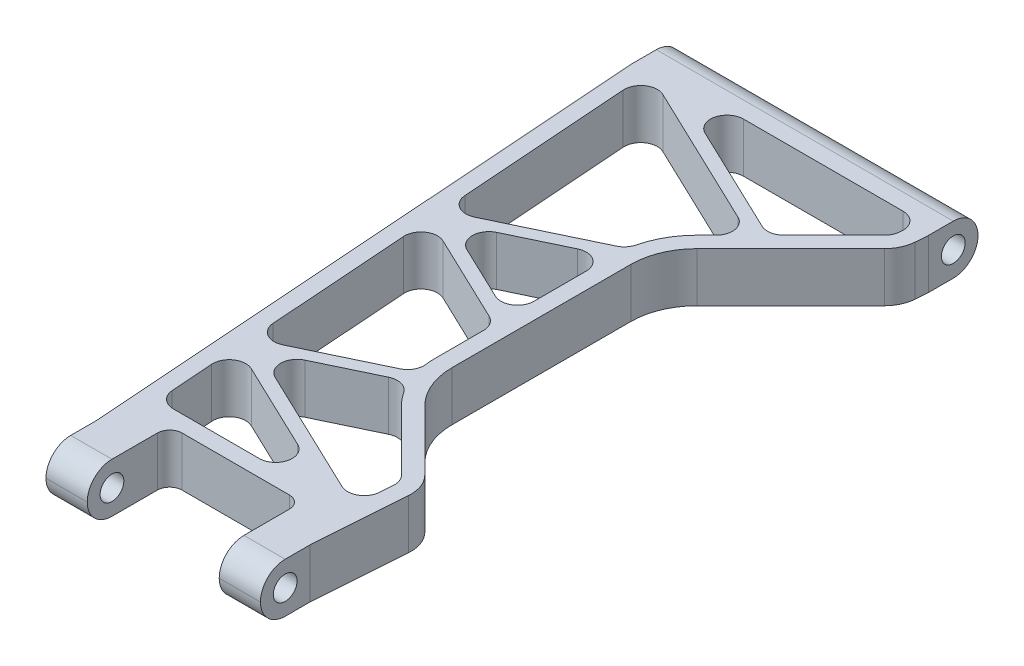
from build123d import *

# Parameters (mm, degrees)
BOSS_EXTRUDE1_DEPTH     = 9.525
CUT_EXTRUDE2_DEPTH      = 139.148989433
CUT_EXTRUDE2_DEPTH_BACK = 139.148989433
SKETCH6_R               = 2.286
FILLET5_R               = 4.7625
FILLET6_R               = 12.7
FILLET7_R               = 6.35
CUT_EXTRUDE3_DEPTH      = 129.978879691
CUT_EXTRUDE3_DEPTH_BACK = 129.978879691
FILLET8_R               = 3.175
FILLET9_R               = 2.38125


# Some blends are built 0.0001 mm under size
with BuildPart() as part:
    # Sketch1 → Boss-Extrude1 (new body)
    with BuildSketch(Plane(origin=(0, 0, 0), x_dir=(1, 0, 0), z_dir=(0, 1, 0))):
        Polygon((-28.575, 4.7625), (-28.575, -4.7625), (-20.6375, -115.8875), (-20.6375, -125.4125), (-12.7, -125.4125), (-12.7, -109.5375), (12.7, -109.5375), (12.7, -125.4125), (20.6375, -125.4125), (20.6375, -115.8875), (22.111607143, -95.25), (4.7625, -77.900892857), (4.7625, -32.997321429), (28.234821429, -9.525), (28.575, -4.7625), (28.575, 4.7625), align=None)
    extrude(amount=BOSS_EXTRUDE1_DEPTH)

    # Sketch6 → Cut-Extrude2 (cut, two sides: drawn at the far end of the back side and taken through both)
    with BuildSketch(Plane.ZY.offset(28.575).offset(-CUT_EXTRUDE2_DEPTH_BACK)):
        with Locations((0, 4.7625)):
            Circle(SKETCH6_R)
        with Locations((120.65, 4.7625)):
            Circle(SKETCH6_R)
    extrude(amount=CUT_EXTRUDE2_DEPTH + CUT_EXTRUDE2_DEPTH_BACK, mode=Mode.SUBTRACT)

    # Fillet5
    fillet5_edges = [part.edges().sort_by_distance(p)[0] for p in [
        (0, 0, -4.7625),
        (0, 9.525, -4.7625),
        (16.66875, 0, 125.4125),
        (16.66875, 9.525, 125.4125),
        (-16.66875, 0, 125.4125),
        (-16.66875, 9.525, 125.4125),
    ]]
    fillet(fillet5_edges, radius=FILLET5_R - 0.0001)  # a hair under: the kernel refuses the full size

    # Fillet6
    fillet6_edges = [part.edges().sort_by_distance(p)[0] for p in [
        (4.7625, 4.7625, 32.997321429),
        (4.7625, 4.7625, 77.900892857),
    ]]
    fillet(fillet6_edges, radius=FILLET6_R)

    # Fillet7
    fillet7_edges = [part.edges().sort_by_distance(p)[0] for p in [
        (28.234821429, 4.7625, 9.525),
        (22.111607143, 4.7625, 95.25),
    ]]
    fillet(fillet7_edges, radius=FILLET7_R)

    # Sketch7 → Cut-Extrude3 (cut, two sides: drawn at the far end of the back side and taken through both)
    with BuildSketch(Plane.XZ.offset(-CUT_EXTRUDE3_DEPTH_BACK)):
        with BuildLine():
            ThreePointArc((-15.178464487, 106.3625), (-17.342073764, 105.511165186), (-18.345395859, 103.413709384))
            Line((-18.345395859, 103.413709384), (-18.929176024, 95.240787072))
            ThreePointArc((-18.929176024, 95.240787072), (-17.550554149, 92.391111633), (-14.394156229, 92.149449581))
            Line((-14.394156229, 92.149449581), (2.722039645, 100.322371894))
            ThreePointArc((2.722039645, 100.322371894), (4.450514376, 103.888871251), (1.353951221, 106.3625))
            Line((1.353951221, 106.3625), (-15.178464487, 106.3625))
        make_face()
        with BuildLine():
            Line((-10.652026542, 85.567257834), (2.949065003, 79.072785266))
            ThreePointArc((2.949065003, 79.072785266), (4.371896924, 81.621011779), (6.237179849, 83.865700766))
            Line((6.237179849, 83.865700766), (17.816220953, 95.444741871))
            ThreePointArc((17.816220953, 95.444741871), (18.545921053, 96.580119743), (18.738088295, 97.916015285))
            Line((18.738088295, 97.916015285), (18.355750526, 103.268744039))
            ThreePointArc((18.355750526, 103.268744039), (16.767104452, 103.883635913), (15.089301508, 103.588906124))
            Line((15.089301508, 103.588906124), (-10.652026542, 91.297514046))
            ThreePointArc((-10.652026542, 91.297514046), (-12.458938118, 88.43238594), (-10.652026542, 85.567257834))
        make_face()
        with BuildLine():
            ThreePointArc((-15.303455952, 85.149509664), (-18.268395024, 85.028592375), (-19.838475748, 82.510590942))
            Line((-19.838475748, 82.510590942), (-21.768351953, 55.492324069))
            ThreePointArc((-21.768351953, 55.492324069), (-20.389730078, 52.642648631), (-17.233332157, 52.400986579))
            Line((-17.233332157, 52.400986579), (1.5875, 61.38786662))
            Line((1.5875, 61.38786662), (1.5875, 72.640380615))
            ThreePointArc((1.5875, 72.640380615), (1.727944926, 74.747369375), (2.146794694, 76.817077393))
            Line((2.146794694, 76.817077393), (-15.303455952, 85.149509664))
        make_face()
        with BuildLine():
            Line((1.5875, 38.618768332), (1.5875, 58.749077544))
            Line((1.5875, 58.749077544), (-13.49120247, 51.549051044))
            ThreePointArc((-13.49120247, 51.549051044), (-15.298114047, 48.683922938), (-13.49120247, 45.818794832))
            Line((-13.49120247, 45.818794832), (1.5875, 38.618768332))
        make_face()
        with BuildLine():
            ThreePointArc((-18.142631881, 45.401046662), (-21.107570953, 45.280129373), (-22.677651676, 42.76212794))
            Line((-22.677651676, 42.76212794), (-25.022707709, 9.93134348))
            ThreePointArc((-25.022707709, 9.93134348), (-23.644085834, 7.081668041), (-20.487687914, 6.84000599))
            Line((-20.487687914, 6.84000599), (11.26695768, 22.002735688))
            Line((11.26695768, 22.002735688), (6.237179849, 27.032513519))
            ThreePointArc((6.237179849, 27.032513519), (3.290050222, 31.105401057), (1.764238406, 35.895587299))
            Line((1.764238406, 35.895587299), (-18.142631881, 45.401046662))
        make_face()
        with BuildLine():
            ThreePointArc((-9.987271687, 9.215128106), (-11.715746418, 5.648628749), (-8.619183264, 3.175))
            Line((-8.619183264, 3.175), (22.095428773, 3.175))
            ThreePointArc((22.095428773, 3.175), (24.419093959, 4.186390723), (25.262360145, 6.576209384))
            Line((25.262360145, 6.576209384), (25.236657334, 6.936048729))
            ThreePointArc((25.236657334, 6.936048729), (24.957868459, 8.028648627), (24.314789993, 8.954903375))
            Line((24.314789993, 8.954903375), (13.052944458, 20.21674891))
            Line((13.052944458, 20.21674891), (-9.987271687, 9.215128106))
        make_face()
    extrude(amount=CUT_EXTRUDE3_DEPTH + CUT_EXTRUDE3_DEPTH_BACK, mode=Mode.SUBTRACT)

    # Fillet8
    # the kernel refuses this fillet: 3.175 mm, written as the material it adds along each edge
    with BuildSketch(Plane(origin=(2.146794694, 0, 76.817077393), x_dir=(-0.19425863373245403, 0, -0.9809503469699169), z_dir=(0, 1, 0))) as fillet8_piece_1:
        with BuildLine():
            CenterArc((2.468233166, 3.167061169), FILLET8_R, 194.322890181, 71.624501931)
            Line((-0.608078232, 2.381610227), (0, 0))
            ThreePointArc((0, 0), (1.121924166, 0.039694156), (2.243848333, 0))
        make_face()
    extrude(amount=9.525)
    with BuildSketch(Plane(origin=(1.5875, 0, 61.38786662), x_dir=(0, 0, 1), z_dir=(0, 1, 0))) as fillet8_piece_2:
        with BuildLine():
            CenterArc((FILLET8_R * 0.630656469631, -FILLET8_R), FILLET8_R, 90, 64.475691518)
            Line((-FILLET8_R * 0.271746083545, -FILLET8_R * 0.569106008372), (0, 0))
            Line((0, 0), (FILLET8_R * 0.630656469631, 0))
        make_face()
    extrude(amount=9.525)
    with BuildSketch(Plane(origin=(2.949065003, 9.525, 79.072785266), x_dir=(0.482167275870273, 0, 0.8760791734083397), z_dir=(0, -1, 0))) as fillet8_piece_3:
        with BuildLine():
            CenterArc((2.997736865, 3.163282633), FILLET8_R, 183.302737657, 81.773303175)
            Line((-0.171989666, 2.980365394), (0, 0))
            ThreePointArc((0, 0), (1.362607666, 0.058586837), (2.725215332, 0))
        make_face()
    extrude(amount=9.525)
    with BuildSketch(Plane(origin=(18.355750526, 0, 103.268744039), x_dir=(-0.9990488574203268, 0, -0.04360482183359276), z_dir=(0, 1, 0))) as fillet8_piece_4:
        with BuildLine():
            CenterArc((3.095288472, -2.922058213), FILLET8_R, 66.97485618, 111.438691702)
            Line((-0.078494517, -2.834157465), (-0.395872815, -2.82536739))
            Line((-0.395872815, -2.82536739), (-0.317378299, 0.008790075))
            Line((-0.317378299, 0.008790075), (-0.200752777, 0.245976772))
            ThreePointArc((-0.200752777, 0.245976772), (3.373566927, 0.754496314), (4.461327625, 0.292205821))
            Line((4.461327625, 0.292205821), (4.337142248, 0))
        make_face()
    extrude(amount=9.525)
    with BuildSketch(Plane(origin=(1.764238406, 9.525, 35.895587299), x_dir=(-0.9024025531760991, 0, 0.4308939916281702), z_dir=(0, -1, 0))) as fillet8_piece_5:
        with BuildLine():
            CenterArc((1.589224556, 3.175), FILLET8_R, 219.319739753, 50.680260247)
            ThreePointArc((-0.867025133, 1.163169374), (-0.420218411, 0.591494135), (0, 0))
            Line((0, 0), (1.589224556, 0))
        make_face()
    extrude(amount=9.525)
    with BuildSketch(Plane(origin=(11.26695768, 9.525, 22.002735688), x_dir=(-0.7071067811865471, 0, 0.7071067811865479), z_dir=(0, -1, 0))) as fillet8_piece_6:
        with BuildLine():
            CenterArc((FILLET8_R * 1.4143306163, FILLET8_R), FILLET8_R, 160.524308482, 109.475691518)
            Line((FILLET8_R * 0.471547588134, FILLET8_R * 1.33340690126), (0, 0))
            Line((0, 0), (FILLET8_R * 1.4143306163, 0))
        make_face()
    extrude(amount=9.525)
    with BuildSketch(Plane(origin=(1.5875, 0, 58.749077544), x_dir=(-0.9024025531760999, 0, -0.4308939916281688), z_dir=(0, 1, 0))) as fillet8_piece_7:
        with BuildLine():
            CenterArc((FILLET8_R * 1.58564931647, -FILLET8_R), FILLET8_R, 90, 115.524308482)
            Line((FILLET8_R * 0.683246763298, -FILLET8_R * 1.43089399163), (0, 0))
            Line((0, 0), (FILLET8_R * 1.58564931647, 0))
        make_face()
    extrude(amount=9.525)
    with BuildSketch(Plane(origin=(1.5875, 9.525, 38.618768332), x_dir=(0, 0, 1), z_dir=(0, -1, 0))) as fillet8_piece_8:
        with BuildLine():
            CenterArc((FILLET8_R * 1.58564931647, FILLET8_R), FILLET8_R, 154.475691518, 115.524308482)
            Line((FILLET8_R * 0.683246763298, FILLET8_R * 1.43089399163), (0, 0))
            Line((0, 0), (FILLET8_R * 1.58564931647, 0))
        make_face()
    extrude(amount=9.525)
    with BuildSketch(Plane(origin=(13.052944458, 9.525, 20.21674891), x_dir=(-0.9024025531761012, 0, -0.4308939916281661), z_dir=(0, -1, 0))) as fillet8_piece_9:
        with BuildLine():
            CenterArc((FILLET8_R * 0.707048259068, FILLET8_R), FILLET8_R, 199.475691518, 70.524308482)
            Line((-FILLET8_R * 0.235734769096, FILLET8_R * 0.666593098742), (0, 0))
            Line((0, 0), (FILLET8_R * 0.707048259068, 0))
        make_face()
    extrude(amount=9.525)

    # Fillet9
    fillet9_edges = [part.edges().sort_by_distance(p)[0] for p in [
        (12.7, 4.7625, 109.5375),
        (-12.7, 4.7625, 109.5375),
    ]]
    fillet(fillet9_edges, radius=FILLET9_R)


solid = part.part
